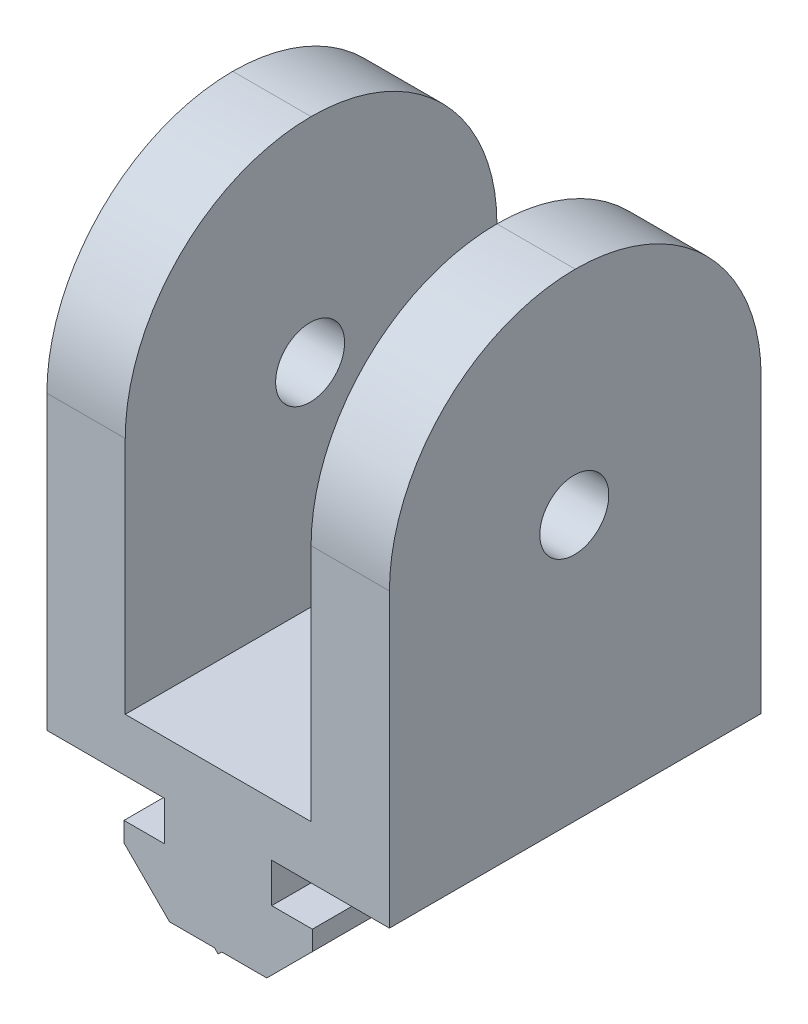
from build123d import *

# Parameters (mm, degrees)
SKETCH1_W           = 150
SKETCH1_H           = 70
BOSS_EXTRUDE1_DEPTH = 10
SKETCH2_W           = 18
SKETCH2_H           = 70
BOSS_EXTRUDE2_DEPTH = 80
FILLET1_R           = 35
SKETCH3_R           = 6.5
CUT_EXTRUDE1_DEPTH  = 164.102034121
RIB1_REACH          = 134.904
SKETCH5_WALL_W      = 321.142477346
SKETCH5_WALL_H      = 40
SKETCH7_W           = 43.830511012
SKETCH7_H           = 10.028409091
CUT_EXTRUDE2_DEPTH  = 80
SCALE1_SCALE        = 0.31
BOSS_EXTRUDE4_DEPTH = 21.7
CUT_EXTRUDE5_REACH  = 46.882
SKETCH11_W          = 1.005
SKETCH11_H          = 10.85
SKETCH11_H_2        = 13.95


with BuildPart() as part:
    # Sketch1 → Boss-Extrude1 (new body)
    with BuildSketch(Plane(origin=(0, 0, 0), x_dir=(1, 0, 0), z_dir=(0, 1, 0))):
        with Locations((14.225473782, -5.028409091)):
            Rectangle(SKETCH1_W, SKETCH1_H)
    extrude(amount=BOSS_EXTRUDE1_DEPTH)

    # Sketch2 → Boss-Extrude2 (add)
    with BuildSketch(Plane(origin=(0, 10, 0), x_dir=(1, 0, 0), z_dir=(0, 1, 0))):
        with Locations((-31.774526218, -5.028409091)):
            Rectangle(SKETCH2_W, SKETCH2_H)
        with Locations((21.225473782, -5.028409091)):
            Rectangle(SKETCH2_W, SKETCH2_H)
    extrude(amount=BOSS_EXTRUDE2_DEPTH)

    # Fillet1
    fillet1_edges = [part.edges().sort_by_distance(p)[0] for p in [
        (21.225473782, 90, 40.028409091),
        (21.225473782, 90, -29.971590909),
        (-31.774526218, 90, -29.971590909),
        (-31.774526218, 90, 40.028409091),
    ]]
    fillet(fillet1_edges, radius=FILLET1_R - 0.0001)  # a hair under: the kernel refuses the full size

    # Sketch3 → Cut-Extrude1 (cut, through all)
    with BuildSketch(Plane.ZY.offset(40.774526218)):
        with Locations((5.212032143, 50)):
            Circle(SKETCH3_R)
    extrude(amount=-CUT_EXTRUDE1_DEPTH, mode=Mode.SUBTRACT)

    # Sketch5 wall → Rib1 (add, up to next)
    with BuildSketch(Plane(origin=(52.140729288, 25.194278726, 0), x_dir=(0.821802771323, -0.569772064116, 0), z_dir=(0.569772064116, 0.821802771323, 0)), mode=Mode.PRIVATE) as rib1_sk1:
        Rectangle(SKETCH5_WALL_W, SKETCH5_WALL_H)
    rib1_tool1 = extrude(rib1_sk1.sketch, amount=-RIB1_REACH, mode=Mode.PRIVATE) - part.part
    add(rib1_tool1.solids().sort_by_distance((52.140729288, 25.194278726, 0))[0])

    # Sketch7 → Cut-Extrude2 (cut)
    with BuildSketch(Plane(origin=(0, 10, 0), x_dir=(1, 0, 0), z_dir=(0, 1, 0))):
        with Locations((52.140729288, 14.985795454)):
            Rectangle(SKETCH7_W, SKETCH7_H)
    extrude(amount=CUT_EXTRUDE2_DEPTH, mode=Mode.SUBTRACT)


with BuildPart() as part_1:
    # Scale1: scaled about (0, 0, 0)
    add(part.part.scale(SCALE1_SCALE))

    # Sketch10 → Boss-Extrude4 (add)
    with BuildSketch(Plane(origin=(0, 0, -9.291193182), x_dir=(-1, 0, 0), z_dir=(0, 0, -1))):
        Polygon((4.760103128, -1.455), (4.760103128, 0), (-1.489896872, 0), (-1.489896872, -1.455), (-1.489896872, -1.8), (-1.489896872, -2.3), (-3.864896872, -2.3), (-3.864896872, -3.439339828), (-1.204236701, -6.1), (1.425103128, -6.1), (1.635103128, -6.31), (1.845103128, -6.1), (4.474442956, -6.1), (7.135103128, -3.439339828), (7.135103128, -2.3), (4.760103128, -2.3), (4.760103128, -1.8), align=None)
    extrude(amount=-BOSS_EXTRUDE4_DEPTH)

    # Sketch11 → Cut-Extrude5 (cut, up to next)
    with BuildSketch(Plane(origin=(0, 0, -9.291193182), x_dir=(-1, 0, 0), z_dir=(0, 0, -1)), mode=Mode.PRIVATE) as cut_extrude5_sk1:
        Polygon((-9.369896872, 3.1), (-8.364896872, 3.1), (-8.364896872, 17.05), (-9.369896872, 17.05), (-9.369896872, 12.52045281), align=None)
    cut_extrude5_tool1 = extrude(cut_extrude5_sk1.sketch, amount=-CUT_EXTRUDE5_REACH, mode=Mode.PRIVATE) & part_1.part
    # Sketch11 → Cut-Extrude5 (cut, up to next)
    with BuildSketch(Plane(origin=(0, 0, -9.291193182), x_dir=(-1, 0, 0), z_dir=(0, 0, -1)), mode=Mode.PRIVATE) as cut_extrude5_sk2:
        with Locations((-8.867396872, 22.475)):
            Rectangle(SKETCH11_W, SKETCH11_H)
    cut_extrude5_tool2 = extrude(cut_extrude5_sk2.sketch, amount=-CUT_EXTRUDE5_REACH, mode=Mode.PRIVATE) & part_1.part
    # Sketch11 → Cut-Extrude5 (cut, up to next)
    with BuildSketch(Plane(origin=(0, 0, -9.291193182), x_dir=(-1, 0, 0), z_dir=(0, 0, -1)), mode=Mode.PRIVATE) as cut_extrude5_sk3:
        Polygon((-22.957355286, 3.1), (-9.369896872, 3.1), (-9.369896872, 12.52045281), align=None)
    cut_extrude5_tool3 = extrude(cut_extrude5_sk3.sketch, amount=-CUT_EXTRUDE5_REACH, mode=Mode.PRIVATE) & part_1.part
    # Sketch11 → Cut-Extrude5 (cut, up to next)
    with BuildSketch(Plane(origin=(0, 0, -9.291193182), x_dir=(-1, 0, 0), z_dir=(0, 0, -1)), mode=Mode.PRIVATE) as cut_extrude5_sk4:
        Polygon((-8.364896872, 0), (-8.364896872, 3.1), (-9.369896872, 3.1), (-22.957355286, 3.1), (-27.659896872, 3.1), (-27.659896872, 0), align=None)
    cut_extrude5_tool4 = extrude(cut_extrude5_sk4.sketch, amount=-CUT_EXTRUDE5_REACH, mode=Mode.PRIVATE) & part_1.part
    # Sketch11 → Cut-Extrude5 (cut, up to next)
    with BuildSketch(Plane(origin=(0, 0, -9.291193182), x_dir=(-1, 0, 0), z_dir=(0, 0, -1)), mode=Mode.PRIVATE) as cut_extrude5_sk5:
        with Locations((12.137603128, 10.075)):
            Rectangle(SKETCH11_W, SKETCH11_H_2)
    cut_extrude5_tool5 = extrude(cut_extrude5_sk5.sketch, amount=-CUT_EXTRUDE5_REACH, mode=Mode.PRIVATE) & part_1.part
    # Sketch11 → Cut-Extrude5 (cut, up to next)
    with BuildSketch(Plane(origin=(0, 0, -9.291193182), x_dir=(-1, 0, 0), z_dir=(0, 0, -1)), mode=Mode.PRIVATE) as cut_extrude5_sk6:
        with Locations((12.137603128, 22.475)):
            Rectangle(SKETCH11_W, SKETCH11_H)
    cut_extrude5_tool6 = extrude(cut_extrude5_sk6.sketch, amount=-CUT_EXTRUDE5_REACH, mode=Mode.PRIVATE) & part_1.part
    # Sketch11 → Cut-Extrude5 (cut, up to next)
    with BuildSketch(Plane(origin=(0, 0, -9.291193182), x_dir=(-1, 0, 0), z_dir=(0, 0, -1)), mode=Mode.PRIVATE) as cut_extrude5_sk7:
        Polygon((12.640103128, 3.1), (11.635103128, 3.1), (11.635103128, 0), (18.840103128, 0), (18.840103128, 3.1), align=None)
    cut_extrude5_tool7 = extrude(cut_extrude5_sk7.sketch, amount=-CUT_EXTRUDE5_REACH, mode=Mode.PRIVATE) & part_1.part
    add(cut_extrude5_tool1.solids().sort_by_distance((8.867397, 10.075, -9.291193))[0], mode=Mode.SUBTRACT)
    add(cut_extrude5_tool2.solids().sort_by_distance((8.867397, 22.475, -9.291193))[0], mode=Mode.SUBTRACT)
    add(cut_extrude5_tool3.solids().sort_by_distance((13.89905, 6.240151, -9.291193))[0], mode=Mode.SUBTRACT)
    add(cut_extrude5_tool4.solids().sort_by_distance((18.012397, 1.55, -9.291193))[0], mode=Mode.SUBTRACT)
    add(cut_extrude5_tool5.solids().sort_by_distance((-12.137603, 10.075, -9.291193))[0], mode=Mode.SUBTRACT)
    add(cut_extrude5_tool6.solids().sort_by_distance((-12.137603, 22.475, -9.291193))[0], mode=Mode.SUBTRACT)
    add(cut_extrude5_tool7.solids().sort_by_distance((-15.237603, 1.55, -9.291193))[0], mode=Mode.SUBTRACT)


solid = part_1.part
